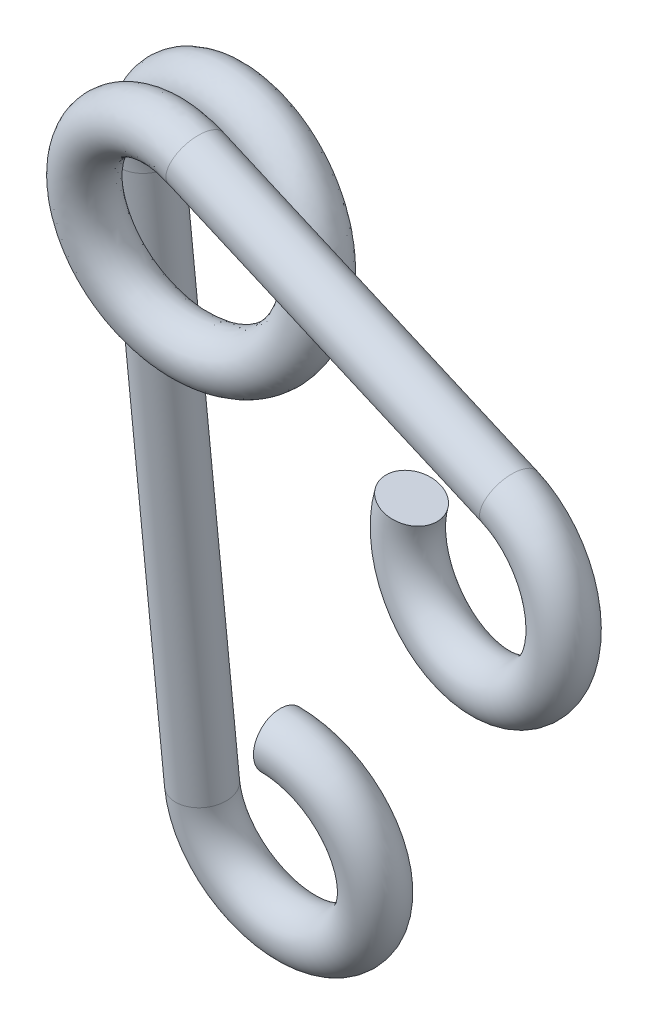
from build123d import *

# Parameters (mm, degrees)
SWEEP1_PITCH        = 1.779213779
SWEEP1_HEIGHT       = 2.304
SWEEP1_RADIUS       = 2.925
SWEEP1_START_ANGLE  = -180
SWEEP1_PROFILE_R    = 0.772
SKETCH7_R           = 0.772
BOSS_EXTRUDE1_DEPTH = 16.8
SKETCH8_R           = 0.772
BOSS_EXTRUDE2_DEPTH = 10.57
SKETCH11_R          = 0.772
SKETCH13_R          = 0.772


with BuildPart() as part:
    # Sweep1: sweep along a helix
    with BuildLine() as sweep1_path:
        add(Helix(SWEEP1_PITCH, SWEEP1_HEIGHT, SWEEP1_RADIUS, center=(0, 0, 0), direction=(0, 0, 1), lefthand=True, mode=Mode.PRIVATE).rotate(Axis((0, 0, 0), (0, 0, 1)), SWEEP1_START_ANGLE))
    # Sweep1 profile (on start of the path) → Sweep1 (sweep)
    with BuildSketch(Plane(origin=(-2.925, 0, 0), x_dir=(0, -0.09635998191573415, 0.9953465496424848), z_dir=(3.597284925943457e-13, 0.9953465496424848, 0.09635998191573415))):
        Circle(SWEEP1_PROFILE_R)
    sweep(path=sweep1_path.line, is_frenet=True)

    # Sketch7 → Boss-Extrude1 (add)
    with BuildSketch(Plane(origin=(0, 0, 0), x_dir=(1, 0, 0), z_dir=(7.675357685849381e-15, -0.9953465496424846, -0.09635998191573725))):
        with Locations(Location((-2.925, 0, 0), (0, 0, 90))):
            Circle(SKETCH7_R)
    extrude(amount=BOSS_EXTRUDE1_DEPTH)


with BuildPart() as boss_extrude2_tool:
    # Sketch8 → Boss-Extrude2 (new body)
    with BuildSketch(Plane(origin=(0.212247465, -0.061595199, 0.021395545), x_dir=(0.09353191621905146, -0.023442339284879547, -0.9953402621100208), z_dir=(0.9559074848197946, -0.27740878564078186, 0.09635998191573734))):
        with Locations(Location((-2.283117967, 2.933133661, 0), (0, 0, 179.796346996))):
            Circle(SKETCH8_R)
    extrude(amount=BOSS_EXTRUDE2_DEPTH)


with BuildPart() as part_1:
    add(part.part)


with BuildPart() as part_2:
    # Boss-Extrude2: joined with boss_extrude2_tool
    add(part_1.part.fuse(boss_extrude2_tool.part, tol=0.00001))

    # Sweep2: sweep along a path in Sketch10
    with BuildLine(Plane(origin=(0, 0, 0), x_dir=(1, 0, 0), z_dir=(-1.1470381111266431e-14, -0.09635998191573725, 0.9953465496424845))) as sweep2_path:
        ThreePointArc((-2.925, -16.8), (1.342766953, -18.567766953), (-0.425, -14.3))
    # Sketch11 → Sweep2 (sweep)
    with BuildSketch(Plane(origin=(0, -16.721822034, -1.618847696), x_dir=(1, 0, 0), z_dir=(7.675357685849381e-15, -0.9953465496424845, -0.09635998191573723))):
        with Locations((-2.925, 0)):
            Circle(SKETCH11_R)
    sweep(path=sweep2_path.line)

    # Sweep3: sweep along a path in Sketch12
    with BuildLine(Plane(origin=(-0.213544398, 0.053521626, 2.272479236), x_dir=(-0.9956162536810559, -0.0019645261204809467, -0.09351158240143997), z_dir=(0.09353191621905146, -0.023442339284879526, -0.9953402621100208))) as sweep3_path:
        ThreePointArc((-11.181765828, -0.198652929), (-11.686848987, -4.790354767), (-8.082877753, -1.900678987))
    # Sketch13 → Sweep3 (sweep)
    with BuildSketch(Plane(origin=(10.316189579, -2.993806063, 1.039920554), x_dir=(0.09353191621905066, -0.023442339284882305, -0.9953402621100208), z_dir=(0.9559074848197945, -0.27740878564078186, 0.09635998191573733))):
        with Locations((-2.283117967, 2.933133661)):
            Circle(SKETCH13_R)
    sweep(path=sweep3_path.line)


solid = part_2.part
